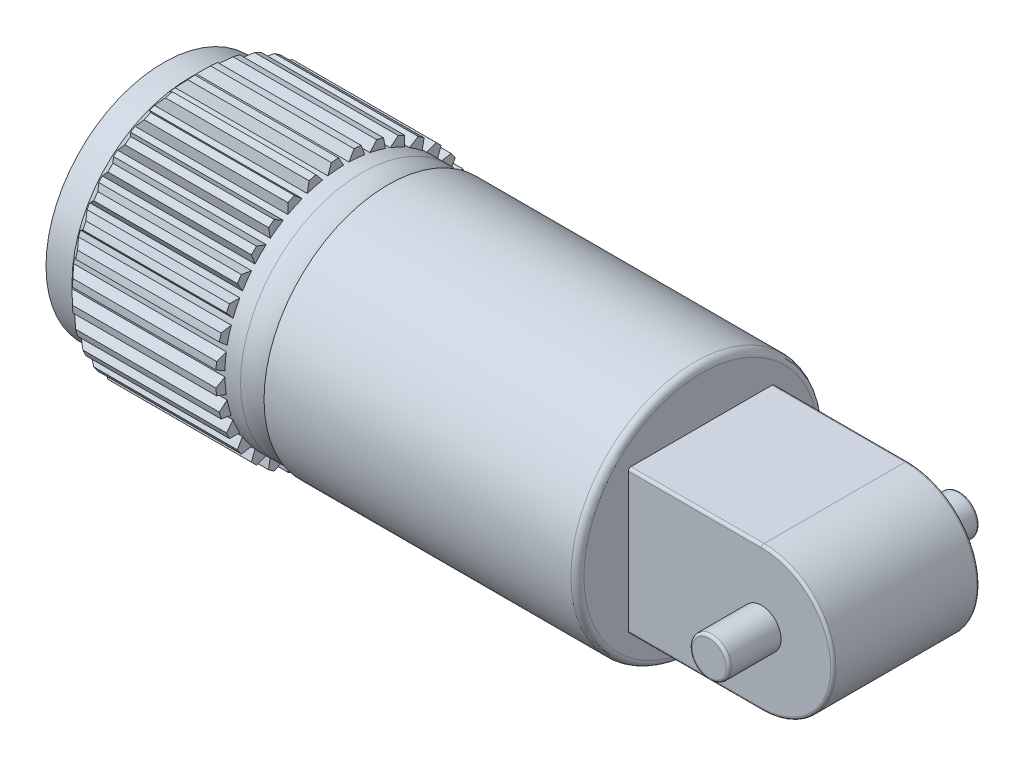
from build123d import *
from build123d.topology import SkipClean

# Parameters (mm, degrees)
FILLET_1_R               = 0.25
EXTRUDE_1_DEPTH          = 2.8
FILLET_2_R               = 0.1
SKETCH_3_R               = 0.75
EXTRUDE_2_DEPTH          = 2
FILLET_3_R               = 0.1
FILLET_3_OF_MIRROR_1_R   = 0.1
CUT_EXTRUDE_1_DEPTH      = 23.58544895
PATTERN_CIRCULAR_1_COUNT = 36


with BuildPart() as part:
    # Эскиз1 → Повернуть1 (revolve)
    with BuildSketch(Plane.XY):
        with BuildLine():
            Line((1, 0), (20.6, 0))
            Line((20.6, 0), (20.6, 4.75))
            Line((20.6, 4.75), (8.6, 4.75))
            Line((8.6, 4.75), (8.6, 4.2989996))
            ThreePointArc((8.6, 4.2989996), (8.129905954, 4.559701851), (7.6, 4.65))
            Line((7.6, 4.65), (7, 4.65))
            Line((7, 4.65), (7, 5))
            Line((7, 5), (1.5, 5))
            Line((1.5, 5), (1, 4.5))
            Line((1, 4.5), (0, 4.5))
            Line((0, 4.5), (0, 3.3))
            Line((0, 3.3), (1, 3.3))
            Line((1, 3.3), (1, 2.62))
            Line((1, 2.62), (5, 2.62))
            Line((5, 2.62), (5, 2.35))
            Line((5, 2.35), (3, 2.35))
            Line((3, 2.35), (3, 2.25))
            Line((3, 2.25), (3.05, 2.25))
            Line((3.05, 2.25), (3.05, 0.45))
            Line((3.05, 0.45), (1.45, 0.45))
            ThreePointArc((1.45, 0.45), (1.131801948, 0.318198052), (1, 0))
        make_face()
    revolve(axis=Axis((1, 0, 0), (1, 0, 0)))

    # Скругление1
    fillet_1_edges = [part.edges().sort_by_distance(p)[0] for p in [
        (20.6, -4.75, 0),
    ]]
    fillet(fillet_1_edges, radius=FILLET_1_R)

    # Эскиз2 → Бобышка-Вытянуть1 (add, symmetric)
    with BuildSketch(Plane.XY):
        with BuildLine():
            Line((20.6, -2.75), (25.7, -2.75))
            ThreePointArc((25.7, -2.75), (28.45, 0), (25.7, 2.75))
            Line((25.7, 2.75), (20.6, 2.75))
            Line((20.6, 2.75), (20.6, -2.75))
        make_face()
    extrude(amount=EXTRUDE_1_DEPTH, both=True)

    # Скругление2
    fillet_2_edges = [part.edges().sort_by_distance(p)[0] for p in [
        (23.15, -2.75, -2.8),
        (28.45, 0, -2.8),
        (23.15, -2.75, 2.8),
        (28.45, 0, 2.8),
        (23.15, 2.75, -2.8),
        (23.15, 2.75, 2.8),
    ]]
    fillet(fillet_2_edges, radius=FILLET_2_R)

    # Эскиз3 → Бобышка-Вытянуть2 (add)
    with BuildSketch(Plane.XY.offset(2.8)):
        with Locations((25.7, 0)):
            Circle(SKETCH_3_R)
    extrude_2 = extrude(amount=EXTRUDE_2_DEPTH)

    # Скругление3
    fillet_3_edges = [part.edges().sort_by_distance(p)[0] for p in [
        (24.95, 0, 4.8),
    ]]
    fillet(fillet_3_edges, radius=FILLET_3_R)

    # Зеркальное отражение1: Бобышка-Вытянуть2 across plane
    add(extrude_2.mirror(Plane.XY))

    # Скругление3 of Зеркальное отражение1
    fillet_3_of_mirror_1_edges = [part.edges().sort_by_distance(p)[0] for p in [
        (24.95, 0, -4.8),
    ]]
    fillet(fillet_3_of_mirror_1_edges, radius=FILLET_3_OF_MIRROR_1_R)

    # Эскиз4 → Вырез-Вытянуть1 (cut, through all)
    with BuildSketch(Plane(origin=(7, 0, 0), x_dir=(0, 0, -1), z_dir=(1, 0, 0))):
        with BuildLine():
            Line((-0.3, 4.990991885), (-0.102476231, 4.648870682))
            ThreePointArc((-0.102476231, 4.648870682), (0, 4.65), (0.102476231, 4.648870682))
            Line((0.102476231, 4.648870682), (0.3, 4.990991885))
            ThreePointArc((0.3, 4.990991885), (0, 5), (-0.3, 4.990991885))
        make_face()
    cut_extrude_1 = extrude(amount=-CUT_EXTRUDE_1_DEPTH, mode=Mode.SUBTRACT)

    # Круговой массив1: Вырез-Вытянуть1 ×36 about axis
    with SkipClean():  # the faces are left unmerged after this step: merging them gives an invalid solid
        pattern_circular_1_axis = Axis((1, 0, 0), (-1, 0, 0))
        for i in range(1, PATTERN_CIRCULAR_1_COUNT):
            add(cut_extrude_1.rotate(pattern_circular_1_axis, i * 360 / PATTERN_CIRCULAR_1_COUNT), mode=Mode.SUBTRACT)


solid = part.part
